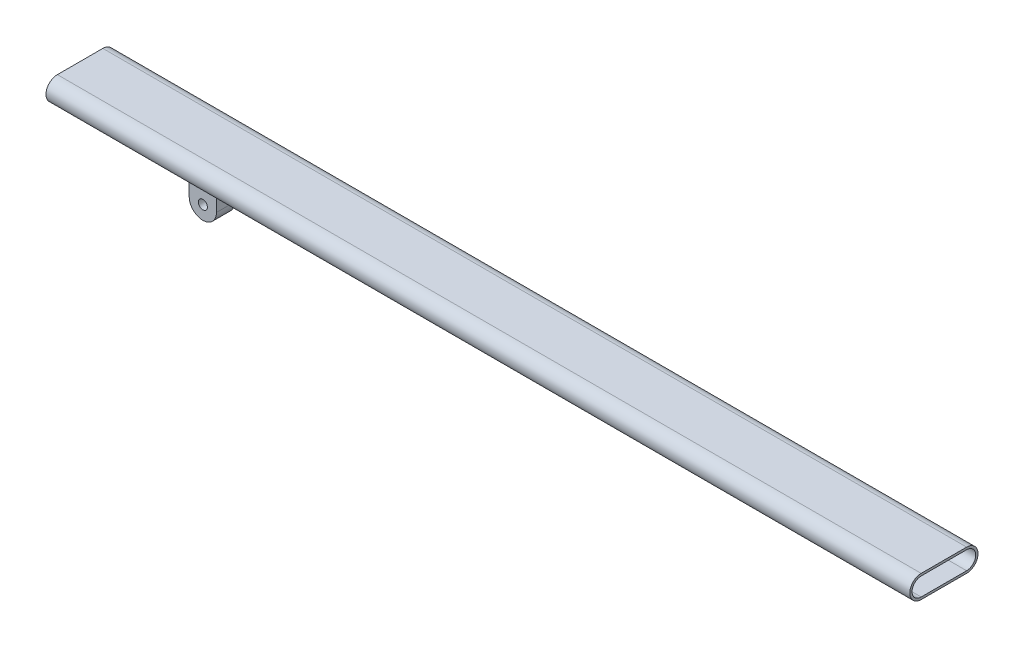
from build123d import *

# Parameters (mm, degrees)
EXTRUDE_1_DEPTH          = 380
CUT_EXTRUDE_1_DEPTH      = 0.5
SKETCH_3_W               = 12
SKETCH_3_H               = 8
EXTRUDE_2_DEPTH          = 20
FILLET_1_R               = 6
CUT_EXTRUDE_2_DEPTH      = 382.084308257
CUT_EXTRUDE_2_DEPTH_BACK = 382.084308257
CUT_EXTRUDE_3_DEPTH      = 9
CUT_EXTRUDE_4_DEPTH      = 382.262704706
CUT_EXTRUDE_4_DEPTH_BACK = 382.262704706
SKETCH_6_R               = 2
HOLE_WIZARD_1_64_1_D     = 1.5113
HOLE_WIZARD_1_64_1_DEPTH = 5.69
HOLE_WIZARD_1_64_1_TIP   = 0.454040327


with BuildPart() as part:
    # 草图1 → 凸台-拉伸1 (new body)
    with BuildSketch(Plane(origin=(0, 0, 0), x_dir=(0, 0, -1), z_dir=(1, 0, 0))):
        with BuildLine():
            Line((10, -5), (-10, -5))
            ThreePointArc((-10, -5), (-15, 0), (-10, 5))
            Line((-10, 5), (10, 5))
            ThreePointArc((10, 5), (15, 0), (10, -5))
        make_face()
    extrude(amount=EXTRUDE_1_DEPTH)

    # 草图2 → 切除-拉伸1 (cut)
    with BuildSketch(Plane.XZ.offset(5)):
        with BuildLine():
            Line((73, -5), (43, -5))
            ThreePointArc((43, -5), (38, 0), (43, 5))
            Line((43, 5), (73, 5))
            ThreePointArc((73, 5), (78, 0), (73, -5))
        make_face()
    extrude(amount=-CUT_EXTRUDE_1_DEPTH, mode=Mode.SUBTRACT)

    # 草图3 → 凸台-拉伸2 (add)
    with BuildSketch(Plane.XZ.offset(4.5)):
        with Locations((58, 0)):
            Rectangle(SKETCH_3_W, SKETCH_3_H)
    extrude(amount=EXTRUDE_2_DEPTH)

    # 圆角1
    fillet_1_edges = [part.edges().sort_by_distance(p)[0] for p in [
        (64, -24.5, 0),
        (52, -24.5, 0),
    ]]
    fillet(fillet_1_edges, radius=FILLET_1_R - 0.0001)  # a hair under: the kernel refuses the full size

    # 草图4 → 切除-拉伸2 (cut, two sides: drawn at the far end of the back side and taken through both)
    with BuildSketch(Plane.ZY.offset(-CUT_EXTRUDE_2_DEPTH_BACK)):
        with BuildLine():
            Line((-10, -4), (10, -4))
            ThreePointArc((10, -4), (14, 0), (10, 4))
            Line((10, 4), (-10, 4))
            ThreePointArc((-10, 4), (-14, 0), (-10, -4))
        make_face()
    extrude(amount=CUT_EXTRUDE_2_DEPTH + CUT_EXTRUDE_2_DEPTH_BACK, mode=Mode.SUBTRACT)

    # 草图5 → 切除-拉伸3 (cut)
    with BuildSketch(Plane.XZ.offset(5)):
        with BuildLine():
            Line((363, -8), (177, -8))
            ThreePointArc((177, -8), (169, 0), (177, 8))
            Line((177, 8), (363, 8))
            ThreePointArc((363, 8), (371, 0), (363, -8))
        make_face()
    extrude(amount=-CUT_EXTRUDE_3_DEPTH, mode=Mode.SUBTRACT)

    # 草图6 → 切除-拉伸4 (cut, two sides: drawn at the far end of the back side and taken through both)
    with BuildSketch(Plane.XY.offset(4).offset(-CUT_EXTRUDE_4_DEPTH_BACK)):
        with Locations((58, -18.5)):
            Circle(SKETCH_6_R)
    extrude(amount=CUT_EXTRUDE_4_DEPTH + CUT_EXTRUDE_4_DEPTH_BACK, mode=Mode.SUBTRACT)

    # #1-64 螺纹孔1
    with Locations(Plane(origin=(0, -4.5, 0), x_dir=(-1, 0, 0), z_dir=(0, -1, 0))):
        with Locations((-43, 0), (-73, 0)):
            Hole(HOLE_WIZARD_1_64_1_D / 2, depth=HOLE_WIZARD_1_64_1_DEPTH)
            with Locations((0, 0, -(HOLE_WIZARD_1_64_1_DEPTH + HOLE_WIZARD_1_64_1_TIP / 2))):  # 118° drill point
                Cone(0, HOLE_WIZARD_1_64_1_D / 2, HOLE_WIZARD_1_64_1_TIP, mode=Mode.SUBTRACT)


solid = part.part
